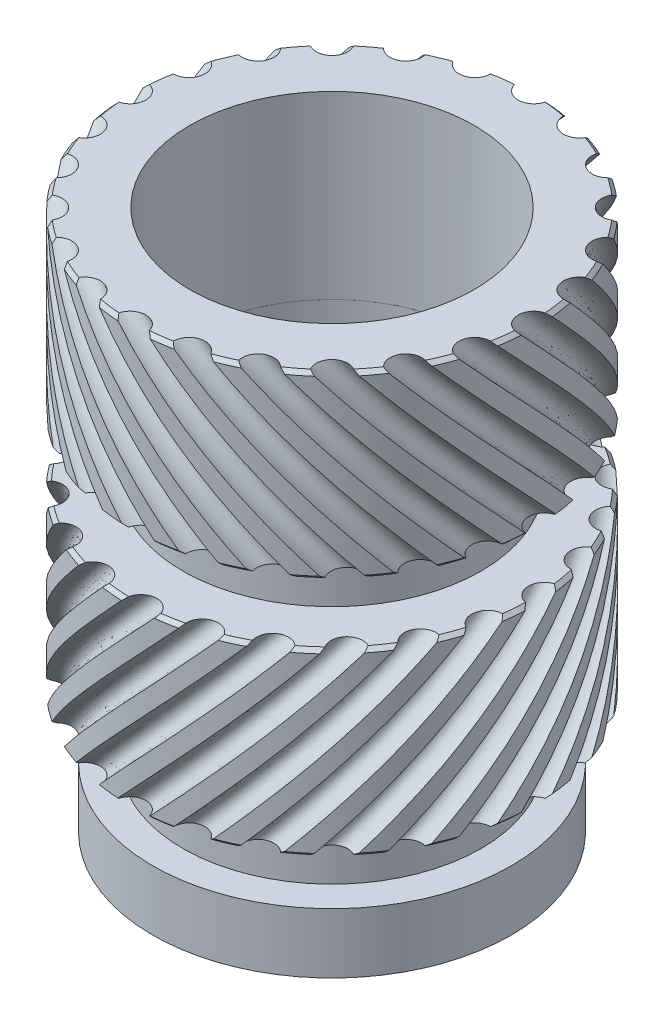
from build123d import *

# Parameters (mm, degrees)
SKETCH3_W              = 3.55
SKETCH3_H              = 3.166666667
CHAMFER1_SIZE          = 0.0635
CUT_SWEEP1_PITCH       = 23.75
CUT_SWEEP1_HEIGHT      = 9.5
CUT_SWEEP1_RADIUS      = 3.55
CUT_SWEEP1_START_ANGLE = -90
SKETCH5_R              = 0.278744692
CIRPATTERN1_COUNT      = 24
SKETCH7_R              = 2.5
CUT_EXTRUDE1_DEPTH     = 11.744998913


with BuildPart() as part:
    # Sketch3 → Revolve1 (revolve)
    with BuildSketch(Plane.XY):
        with Locations((1.775, 7.916666667)):
            Rectangle(SKETCH3_W, SKETCH3_H)
    revolve(axis=Axis((0, 6.333333333, 0), (0, 1, 0)))

    # Chamfer1
    chamfer1_edges = [part.edges().sort_by_distance(p)[0] for p in [
        (-3.55, 6.333333333, 0),
        (-3.55, 9.5, 0),
    ]]
    chamfer(chamfer1_edges, length=CHAMFER1_SIZE)

    # Cut-Sweep1: sweep along a helix
    with BuildLine() as cut_sweep1_path:
        add(Helix(CUT_SWEEP1_PITCH, CUT_SWEEP1_HEIGHT, CUT_SWEEP1_RADIUS, center=(0, 9.5, 0), direction=(0, -1, 0), lefthand=True, mode=Mode.PRIVATE).rotate(Axis((0, 9.5, 0), (0, -1, 0)), CUT_SWEEP1_START_ANGLE))
    # Sketch5 → Cut-Sweep1 (sweep, cut)
    with BuildSketch(Plane(origin=(0, 9.5, 0), x_dir=(1, 0, 0), z_dir=(0, 1, 0))):
        with Locations((0, -3.55)):
            Circle(SKETCH5_R)
    cut_sweep1 = sweep(path=cut_sweep1_path.line, is_frenet=True, mode=Mode.SUBTRACT)

    # CirPattern1: Cut-Sweep1 ×24 about axis
    cirpattern1_axis = Axis((0, 6.333333333, 0), (0, -1, 0))
    for i in range(1, CIRPATTERN1_COUNT):
        add(cut_sweep1.rotate(cirpattern1_axis, i * 360 / CIRPATTERN1_COUNT), mode=Mode.SUBTRACT)


with BuildPart() as body_2:
    # Sketch6 → Revolve2 (revolve)
    with BuildSketch(Plane.XY):
        Polygon((2.622222222, 5.277777778), (2.622222222, 2.111111111), (2.622222222, 1.055555556), (3.15, 1.055555556), (3.15, 0), (0, 0), (0, 6.333333333), (2.622222222, 6.333333333), align=None)
    revolve(axis=Axis((0, 0, 0), (0, 1, 0)))


with BuildPart() as body_3:
    # Mirror2: mirrored copy
    add(part.part.mirror(Plane.ZX.offset(5.805555556)))


with BuildPart() as cut_extrude1_tool:
    # Sketch7 → Cut-Extrude1 (new, through all)
    with BuildSketch(Plane(origin=(0, 9.5, 0), x_dir=(1, 0, 0), z_dir=(0, 1, 0))):
        with Locations(Location((0, 0, 0), (0, 0, 180))):
            Circle(SKETCH7_R)
    extrude(amount=-CUT_EXTRUDE1_DEPTH)


with BuildPart() as part_1:
    add(part.part)

    # Cut-Extrude1: cut by cut_extrude1_tool
    add(cut_extrude1_tool.part, mode=Mode.SUBTRACT)


with BuildPart() as body_2_1:
    add(body_2.part)

    # Cut-Extrude1: cut by cut_extrude1_tool
    add(cut_extrude1_tool.part, mode=Mode.SUBTRACT)


with BuildPart() as body_3_1:
    add(body_3.part)

    # Cut-Extrude1: cut by cut_extrude1_tool
    add(cut_extrude1_tool.part, mode=Mode.SUBTRACT)


solid = Compound([part_1.part, body_2_1.part, body_3_1.part])
